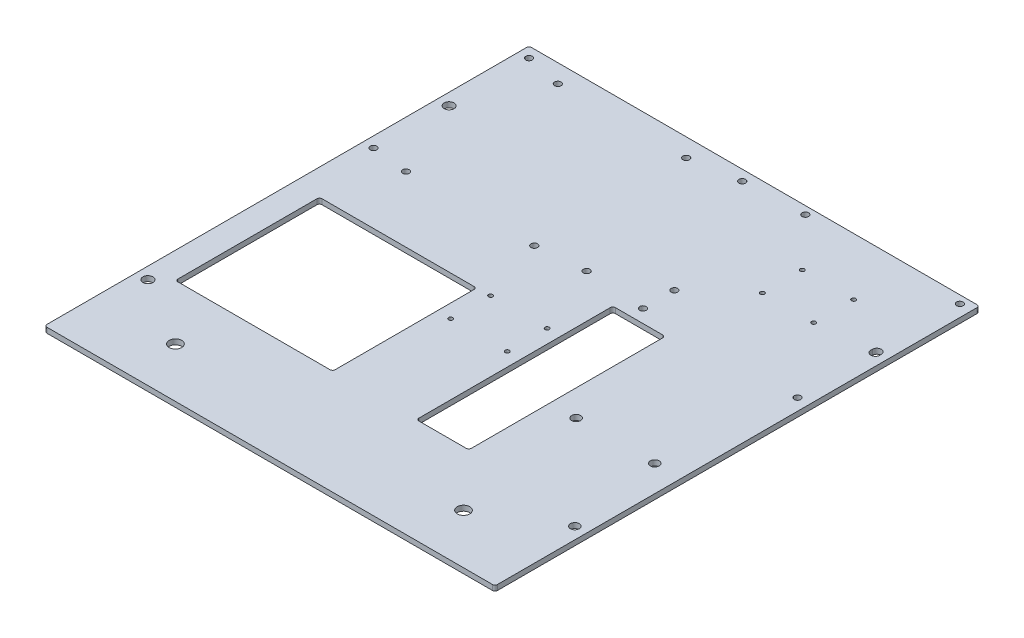
from build123d import *

# Parameters (mm, degrees)
SKIZZE1_W                             = 172
SKIZZE1_H                             = 185
AUFSATZ_LINEAR_AUSTRAGEN1_DEPTH       = 2
DURCHGANGSLOCH_F_R_M31_D              = 3.4
F_3_8_3_8_DURCHMESSER_BOHRUNG1_D      = 3.8
F_3_8_3_8_DURCHMESSER_BOHRUNG1_DEPTH  = 10
F_3_8_3_8_DURCHMESSER_BOHRUNG1_TIP    = 1.141635176
F_3_4_3_4_DURCHMESSER_LANGLOCH1_DEPTH = 2
SKIZZE5_W                             = 20
SKIZZE5_H                             = 75
SKIZZE5_W_2                           = 60
SKIZZE5_H_2                           = 55
SCHNITT_LINEAR_AUSTRAGEN1_DEPTH       = 10
F_4_3_4_79_DURCHMESSER_BOHRUNG1_D     = 4.79
DURCHGANGSLOCH_F_R_M32_D              = 3.4
M3X0_5_GEWINDEBOHRUNG2_D              = 2.5
M3X0_5_GEWINDEBOHRUNG3_D              = 2.5
VERRUNDUNG1_R                         = 1
M2X0_4_GEWINDEBOHRUNG1_D              = 1.6


# Read off the part's stored shape, not the designer's step: Ø3.4 (3.4) Durchmesser Langloch1
with BuildPart() as part:
    # Skizze1 → Aufsatz-Linear austragen1 (new body)
    with BuildSketch(Plane(origin=(0, 0, 0), x_dir=(1, 0, 0), z_dir=(0, 1, 0))):
        Rectangle(SKIZZE1_W, SKIZZE1_H)
    extrude(amount=AUFSATZ_LINEAR_AUSTRAGEN1_DEPTH)

    # Durchgangsloch für M31 (through all)
    with Locations(Plane(origin=(0, 2, 0), x_dir=(1, 0, 0), z_dir=(0, 1, 0))):
        with Locations((81.5, -57.5)):
            Hole(DURCHGANGSLOCH_F_R_M31_D / 2)

    # Ø3.8 (3.8) Durchmesser Bohrung1
    with Locations(Plane(origin=(0, 2, 0), x_dir=(1, 0, 0), z_dir=(0, 1, 0))):
        with Locations((-81.5, -57.5), (-81.5, 57.5)):
            Hole(F_3_8_3_8_DURCHMESSER_BOHRUNG1_D / 2, depth=F_3_8_3_8_DURCHMESSER_BOHRUNG1_DEPTH)
            with Locations((0, 0, -(F_3_8_3_8_DURCHMESSER_BOHRUNG1_DEPTH + F_3_8_3_8_DURCHMESSER_BOHRUNG1_TIP / 2))):  # 118° drill point
                Cone(0, F_3_8_3_8_DURCHMESSER_BOHRUNG1_D / 2, F_3_8_3_8_DURCHMESSER_BOHRUNG1_TIP, mode=Mode.SUBTRACT)

    # Ø3.4 (3.4) Durchmesser Langloch1 outline → Ø3.4 (3.4) Durchmesser Langloch1 (cut)
    with BuildSketch(Plane(origin=(0, 0, 0), x_dir=(1, 0, 0), z_dir=(0, 1, 0))):
        with BuildLine():
            Line((79.8, 57.8), (79.8, 57.2))
            ThreePointArc((79.8, 57.2), (81.5, 55.5), (83.2, 57.2))
            Line((83.2, 57.2), (83.2, 57.8))
            ThreePointArc((83.2, 57.8), (81.5, 59.5), (79.8, 57.8))
        make_face()
    extrude(amount=F_3_4_3_4_DURCHMESSER_LANGLOCH1_DEPTH, mode=Mode.SUBTRACT)

    # Skizze5 → Schnitt-Linear austragen1 (cut)
    with BuildSketch(Plane(origin=(0, 0, 0), x_dir=(1, 0, 0), z_dir=(0, 1, 0))):
        with Locations((26, -15)):
            Rectangle(SKIZZE5_W, SKIZZE5_H)
        with Locations((-46, -25)):
            Rectangle(SKIZZE5_W_2, SKIZZE5_H_2)
    extrude(amount=SCHNITT_LINEAR_AUSTRAGEN1_DEPTH, mode=Mode.SUBTRACT)

    # Ø4.3 (4.79) Durchmesser Bohrung1 (through all)
    with Locations(Plane(origin=(0, 2, 0), x_dir=(1, 0, 0), z_dir=(0, 1, 0))):
        with Locations((-55, -73.5), (55, -73.5)):
            Hole(F_4_3_4_79_DURCHMESSER_BOHRUNG1_D / 2)

    # Durchgangsloch für M32 (through all)
    with Locations(Plane(origin=(0, 2, 0), x_dir=(1, 0, 0), z_dir=(0, 1, 0))):
        with Locations((46, -21.5), (76, -21.5)):
            Hole(DURCHGANGSLOCH_F_R_M32_D / 2)

    # M3x0.5 Gewindebohrung2 (through all)
    with Locations(Plane(origin=(0, 2, 0), x_dir=(1, 0, 0), z_dir=(0, 1, 0))):
        with Locations((-68, 27.5), (-19, 85.5), (-68, 85.5), (-19, 27.5), (-0.6, 29.1), (-82, 88.5), (-0.6, 88.5), (-82, 29.1)):
            Hole(M3X0_5_GEWINDEBOHRUNG2_D / 2)

    # M3x0.5 Gewindebohrung3 (through all)
    with Locations(Plane(origin=(0, 2, 0), x_dir=(1, 0, 0), z_dir=(0, 1, 0))):
        with Locations((22.5, 27.5), (81.5, 89.5), (22.5, 89.5), (81.5, 27.5), (22.5, 39.5)):
            Hole(M3X0_5_GEWINDEBOHRUNG3_D / 2)

    # Verrundung1
    verrundung1_edges = [part.edges().sort_by_distance(p)[0] for p in [
        (16, 1, -22.5),
        (16, 1, 52.5),
        (36, 1, 52.5),
        (36, 1, -22.5),
        (-76, 1, -2.5),
        (-76, 1, 52.5),
        (-16, 1, 52.5),
        (-16, 1, -2.5),
        (-86, 1, -92.5),
        (86, 1, -92.5),
        (86, 1, 92.5),
        (-86, 1, 92.5),
    ]]
    fillet(verrundung1_edges, radius=VERRUNDUNG1_R)

    # M2x0.4 Gewindebohrung1 (through all)
    with Locations(Plane(origin=(0, 2, 0), x_dir=(1, 0, 0), z_dir=(0, 1, 0))):
        with Locations((10.795, -12.62), (-10.795, -12.62), (-10.795, 2.62), (10.795, 2.62), (40.205, 70.62), (40.205, 55.38), (59.795, 55.38), (59.795, 70.62)):
            Hole(M2X0_4_GEWINDEBOHRUNG1_D / 2)


solid = part.part
